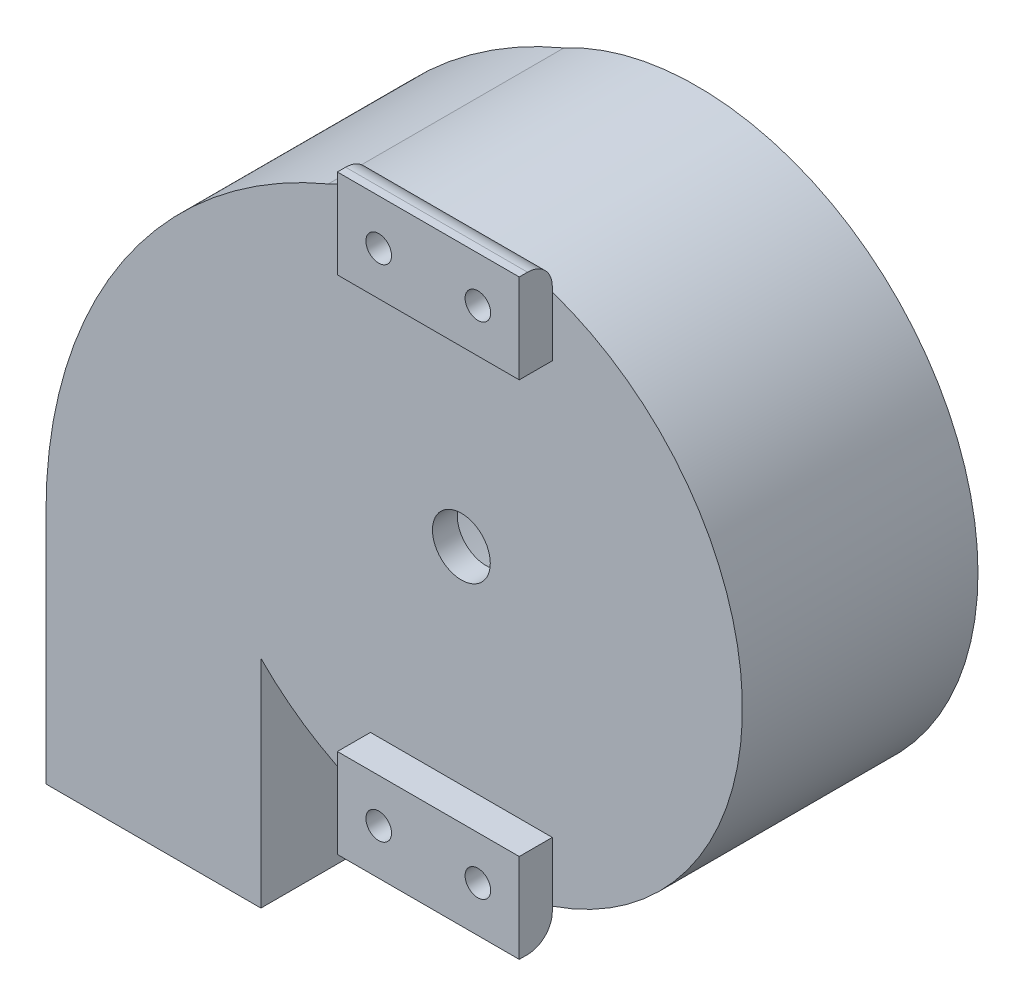
from build123d import *

# Parameters (mm, degrees)
SKETCH1_R            = 34
SKETCH1_R_2          = 31.25
BOSS_EXTRUDE1_DEPTH  = 25.5
SKETCH2_R            = 34
BOSS_EXTRUDE2_DEPTH  = 3
SKETCH5_R            = 3.5
CUT_EXTRUDE3_DEPTH   = 51
BOSS_EXTRUDE9_START  = 25.5
BOSS_EXTRUDE9_DEPTH  = 28.5
CUT_SWEEP6_PROFILE_R = 11
SKETCH219_R          = 12
CUT_EXTRUDE10_DEPTH  = 20
SKETCH227_W          = 22
SKETCH227_H          = 10.782706647
SKETCH227_R          = 1.55
BOSS_EXTRUDE11_DEPTH = 4
FILLET1_R            = 3
FILLET2_R            = 3


with BuildPart() as part:
    # Sketch1 → Boss-Extrude1 (new body)
    with BuildSketch(Plane.XY):
        Circle(SKETCH1_R)
        Circle(SKETCH1_R_2, mode=Mode.SUBTRACT)
    extrude(amount=BOSS_EXTRUDE1_DEPTH)

    # Sketch2 → Boss-Extrude2 (add)
    with BuildSketch(Plane.XY.offset(25.5)):
        Circle(SKETCH2_R)
    extrude(amount=BOSS_EXTRUDE2_DEPTH)

    # Sketch5 → Cut-Extrude3 (cut)
    with BuildSketch(Plane.XY.offset(28.5)):
        Circle(SKETCH5_R)
    extrude(amount=-CUT_EXTRUDE3_DEPTH, mode=Mode.SUBTRACT)

    # Sketch3 → Boss-Extrude9 (add)
    with BuildSketch(Plane(origin=(0, 0, 25.5), x_dir=(-1, 0, 0), z_dir=(0, 0, -1)).offset(BOSS_EXTRUDE9_START)):
        with BuildLine():
            Line((24.25, -50), (50.25, -50))
            Line((50.25, -50), (50.25, -21.368098989))
            ThreePointArc((50.25, -21.368098989), (35.814519651, 16.017355688), (0, 34))
            Line((0, 34), (0, 31.25))
            ThreePointArc((0, 31.25), (28.21801379, 13.427814332), (24.25, -19.710403344))
            Line((24.25, -19.710403344), (24.25, -50))
        make_face()
    extrude(amount=-BOSS_EXTRUDE9_DEPTH)

    # Cut-Sweep6: sweep along a path in Sketch28
    with BuildLine(Plane(origin=(0, 0, 14.25), x_dir=(-1, 0, 0), z_dir=(0, 0, -1))) as cut_sweep6_path:
        Line((37.25, -50), (37.25, -21.368098989))
        ThreePointArc((37.25, -21.368098989), (28.563956157, 4.353039323), (6.0625, 19.54214017))
    # Cut-Sweep6 profile (on start of the path) → Cut-Sweep6 (sweep, cut)
    with BuildSketch(Plane(origin=(-37.25, -50, 14.25), x_dir=(0, 0, 1), z_dir=(0, 1, 0))):
        Circle(CUT_SWEEP6_PROFILE_R)
    sweep(path=cut_sweep6_path.line, mode=Mode.SUBTRACT)

    # Sketch219 → Cut-Extrude10 (cut)
    with BuildSketch(Plane.XZ.offset(50)):
        with Locations(Location((-37.25, 14.25, 0), (0, 0, 270))):
            Circle(SKETCH219_R)
    extrude(amount=-CUT_EXTRUDE10_DEPTH, mode=Mode.SUBTRACT)

    # Sketch227 → Boss-Extrude11 (add)
    # profile 1 of 2: a face of its own
    with BuildSketch(Plane.XY.offset(28.5)):
        with Locations((0, 30.358646677)):
            Rectangle(SKETCH227_W, SKETCH227_H)
        with Locations((-6, 30.25)):
            Circle(SKETCH227_R, mode=Mode.SUBTRACT)
        with Locations((6, 30.25)):
            Circle(SKETCH227_R, mode=Mode.SUBTRACT)
    # profile 2 of 2: a face of its own
    with BuildSketch(Plane.XY.offset(28.5)):
        with Locations((0, -30.358646677)):
            Rectangle(SKETCH227_W, SKETCH227_H)
        with Locations((-6, -30.25)):
            Circle(SKETCH227_R, mode=Mode.SUBTRACT)
        with Locations((6, -30.25)):
            Circle(SKETCH227_R, mode=Mode.SUBTRACT)
    extrude(amount=BOSS_EXTRUDE11_DEPTH)

    # Fillet1
    # the kernel refuses this fillet: 3 mm, written as the material it takes off along each edge
    with BuildSketch(Plane(origin=(-18.5, 35.75, 28.5), x_dir=(0, -1, 0), z_dir=(1, 0, 0))) as fillet1_piece_1_section:
        with BuildLine():
            CenterArc((FILLET1_R, -FILLET1_R), FILLET1_R, 90, 90)
            Line((0, -FILLET1_R), (0, 0))
            Line((0, 0), (FILLET1_R, 0))
        make_face()
    fillet1_piece_1 = extrude(amount=37, mode=Mode.PRIVATE)
    fillet1_piece_1 = fillet1_piece_1 - Plane(origin=(0, 0, 29.19390081), x_dir=(1, 0, 0), z_dir=(0, 0, -1)) * Cylinder(34, 86, mode=Mode.PRIVATE)
    add(fillet1_piece_1, mode=Mode.SUBTRACT)

    # Fillet2
    # the kernel refuses this fillet: 3 mm, written as the material it takes off along each edge
    with BuildSketch(Plane(origin=(-18.5, -35.75, 28.5), x_dir=(0, 1, 0), z_dir=(1, 0, 0))) as fillet2_piece_1_section:
        with BuildLine():
            CenterArc((FILLET2_R, FILLET2_R), FILLET2_R, 180, 90)
            Line((0, FILLET2_R), (0, 0))
            Line((0, 0), (FILLET2_R, 0))
        make_face()
    fillet2_piece_1 = extrude(amount=37, mode=Mode.PRIVATE)
    fillet2_piece_1 = fillet2_piece_1 - Plane(origin=(0, 0, 29.19390081), x_dir=(1, 0, 0), z_dir=(0, 0, -1)) * Cylinder(34, 86, mode=Mode.PRIVATE)
    add(fillet2_piece_1, mode=Mode.SUBTRACT)


solid = part.part
